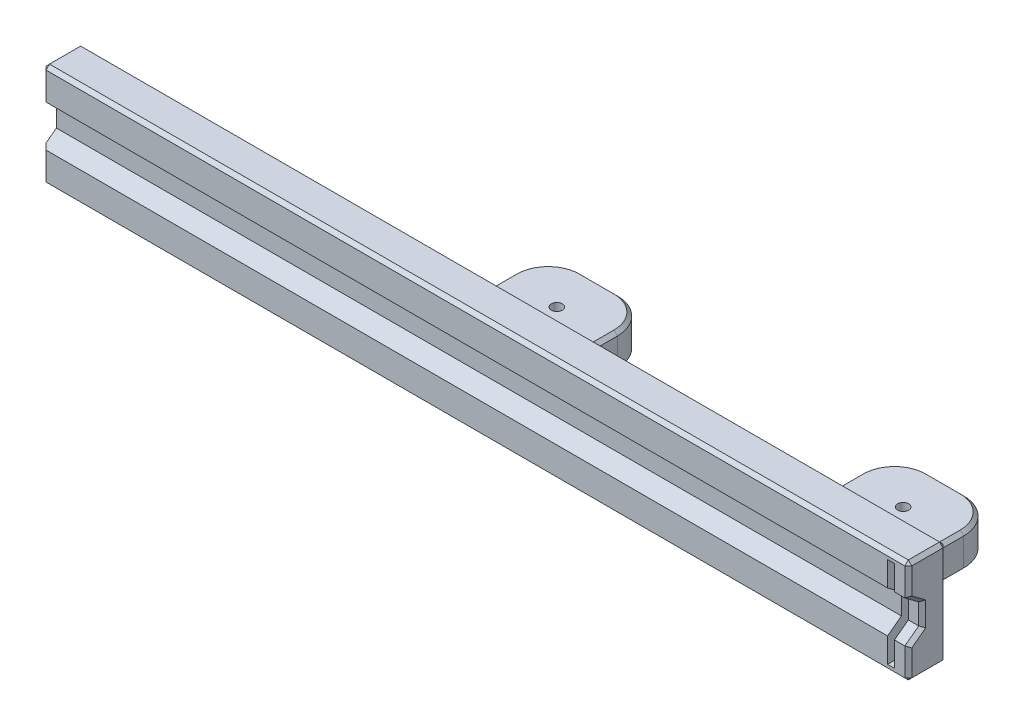
from build123d import *

# Parameters (mm, degrees)
SKETCH_1_W          = 250
SKETCH_1_H          = 30
EXTRUDE_1_DEPTH     = 11
SKETCH_4_W          = 30
SKETCH_4_H          = 10
EXTRUDE_2_DEPTH     = 25
CUT_EXTRUDE_2_DEPTH = 254.031618578
SKETCH_6_R          = 1.6
CUT_EXTRUDE_3_DEPTH = 253.041663223
EXTRUDE_4_DEPTH     = 25
SKETCH_12_R         = 1.6
CUT_EXTRUDE_5_DEPTH = 253.041663223
FILLET_1_R          = 10
SKETCH_13_W         = 2
SKETCH_13_H         = 26.2
CUT_EXTRUDE_6_DEPTH = 7
CHAMFER_1_SIZE      = 1


with BuildPart() as part:
    # 草圖1 → 填料-伸長1 (new body)
    with BuildSketch(Plane.XY):
        with Locations((125, 15)):
            Rectangle(SKETCH_1_W, SKETCH_1_H)
    extrude(amount=EXTRUDE_1_DEPTH)

    # 草圖4 → 填料-伸長2 (add)
    with BuildSketch(Plane(origin=(0, 0, 0), x_dir=(-1, 0, 0), z_dir=(0, 0, -1))):
        with Locations((-125, 15)):
            Rectangle(SKETCH_4_W, SKETCH_4_H)
    extrude(amount=EXTRUDE_2_DEPTH)

    # 草圖5 → 除料-伸長2 (cut, through all)
    with BuildSketch(Plane(origin=(250, 0, 0), x_dir=(0, 0, -1), z_dir=(1, 0, 0))):
        Polygon((-11, 21), (-11, 9), (-7, 12), (-7, 18), align=None)
    extrude(amount=-CUT_EXTRUDE_2_DEPTH, mode=Mode.SUBTRACT)

    # 草圖6 → 除料-伸長3 (cut, through all)
    with BuildSketch(Plane.XZ.offset(-10)):
        with Locations((125, -12.5)):
            Circle(SKETCH_6_R)
    extrude(amount=-CUT_EXTRUDE_3_DEPTH, mode=Mode.SUBTRACT)

    # 草圖11 → 填料-伸長4 (add)
    with BuildSketch(Plane(origin=(0, 0, 0), x_dir=(-1, 0, 0), z_dir=(0, 0, -1))):
        Polygon((-240, 20), (-240, 10), (-210, 10), (-210, 15), (-210, 20), align=None)
    extrude(amount=EXTRUDE_4_DEPTH)

    # 草圖12 → 除料-伸長5 (cut, through all)
    with BuildSketch(Plane(origin=(0, 20, 0), x_dir=(1, 0, 0), z_dir=(0, 1, 0))):
        with Locations((225, 12.5)):
            Circle(SKETCH_12_R)
    extrude(amount=-CUT_EXTRUDE_5_DEPTH, mode=Mode.SUBTRACT)

    # 圓角1
    fillet_1_edges = [part.edges().sort_by_distance(p)[0] for p in [
        (110, 15, -25),
        (140, 15, -25),
        (210, 15, -25),
        (240, 15, -25),
    ]]
    fillet(fillet_1_edges, radius=FILLET_1_R)

    # 草圖13 → 除料-伸長6 (cut)
    with BuildSketch(Plane.XY.offset(11)):
        with Locations((245, 15)):
            Rectangle(SKETCH_13_W, SKETCH_13_H)
    extrude(amount=-CUT_EXTRUDE_6_DEPTH, mode=Mode.SUBTRACT)

    # 導角1
    chamfer_1_edges = [part.edges().sort_by_distance(p)[0] for p in [
        (250, 15, 0),
        (250, 30, 5.5),
        (250, 0, 5.5),
        (125, 30, 11),
        (125, 0, 11),
        (0, 30, 5.5),
        (125, 30, 0),
        (125, 0, 0),
        (0, 15, 0),
        (0, 0, 5.5),
        (225, 10, -25),
        (225, 20, -25),
        (212.928932188, 20, -22.071067812),
        (212.928932188, 10, -22.071067812),
        (237.071067812, 10, -22.071067812),
        (237.071067812, 20, -22.071067812),
        (225, 20, 0),
        (210, 20, -7.5),
        (210, 15, 0),
        (210, 10, -7.5),
        (225, 10, 0),
        (240, 10, -7.5),
        (240, 15, 0),
        (240, 20, -7.5),
        (125, 20, -25),
        (125, 10, -25),
        (112.928932188, 20, -22.071067812),
        (112.928932188, 10, -22.071067812),
        (137.071067812, 20, -22.071067812),
        (137.071067812, 10, -22.071067812),
        (110, 20, -7.5),
        (125, 10, 0),
        (110, 10, -7.5),
        (110, 15, 0),
        (125, 20, 0),
        (140, 20, -7.5),
        (140, 15, 0),
        (140, 10, -7.5),
        (250, 4.5, 11),
        (250, 10.5, 9),
        (250, 15, 7),
        (250, 19.5, 9),
        (250, 25.5, 11),
        (0, 25.5, 11),
        (0, 4.5, 11),
    ]]
    chamfer(chamfer_1_edges, length=CHAMFER_1_SIZE)


solid = part.part
